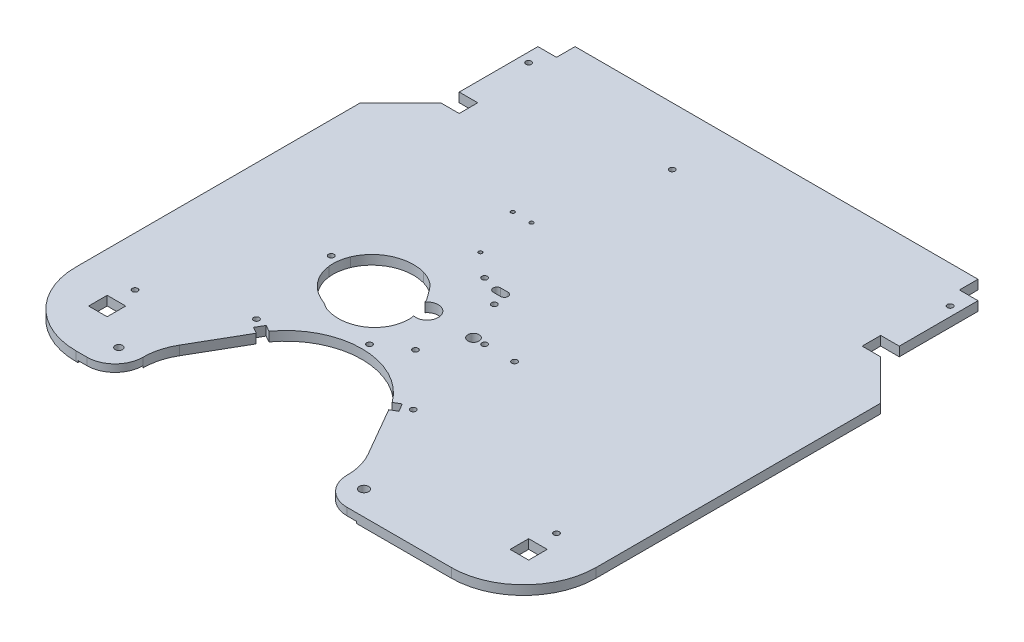
from build123d import *

# Parameters (mm, degrees)
ESQUISSE1_W              = 280.2
ESQUISSE1_H              = 276.282873123
BOSS_EXTRU_1_DEPTH       = 5
ESQUISSE2_R              = 1.5
ENL_V_MAT_EXTRU_2_DEPTH  = 283.344868376
ENL_V_MAT_EXTRU_3_DEPTH  = 283.344868376
ESQUISSE4_R              = 1
ENL_V_MAT_EXTRU_4_DEPTH  = 283.344868514
ESQUISSE5_R              = 1.5
ESQUISSE5_R_2            = 3
ENL_V_MAT_EXTRU_5_DEPTH  = 283.344868514
ESQUISSE6_R              = 6
ENL_V_MAT_EXTRU_6_DEPTH  = 283.344868514
ENL_V_MAT_EXTRU_7_DEPTH  = 283.344868514
ENL_V_MAT_EXTRU_8_DEPTH  = 283.344868514
ENL_V_MAT_EXTRU_9_DEPTH  = 283.344868514
ENL_V_MAT_EXTRU_10_DEPTH = 1
ESQUISSE11_W             = 10
ESQUISSE11_H             = 10
ENL_V_MAT_EXTRU_11_DEPTH = 283.344868514
ESQUISSE12_R             = 2.5
ESQUISSE12_R_2           = 2
ENL_V_MAT_EXTRU_12_DEPTH = 283.344868514
ESQUISSE13_R             = 1.5
ENL_V_MAT_EXTRU_15_DEPTH = 283.344868514


with BuildPart() as part:
    # Esquisse1 → Boss.-Extru.1 (new body)
    with BuildSketch(Plane(origin=(0, 0, 0), x_dir=(1, 0, 0), z_dir=(0, 1, 0))):
        with Locations((0, -106.941436562)):
            Rectangle(ESQUISSE1_W, ESQUISSE1_H)
    extrude(amount=BOSS_EXTRU_1_DEPTH)

    # Esquisse2 → Enlèv. mat.-Extru.2 (cut, through all)
    with BuildSketch(Plane(origin=(0, 0, 0), x_dir=(1, 0, 0), z_dir=(0, 1, 0))):
        with Locations((-67.225778058, -181.665063509)):
            Circle(ESQUISSE2_R)
        with Locations((17.225778058, -181.665063509)):
            Circle(ESQUISSE2_R)
        with BuildLine():
            Line((-58.181549424, -184), (-61.645651039, -182))
            Line((-61.645651039, -182), (-64.145651039, -186.330127019))
            Line((-64.145651039, -186.330127019), (-60.681549424, -188.330127019))
            Line((-60.681549424, -188.330127019), (-75.853895909, -214.609402001))
            ThreePointArc((-75.853895909, -214.609402001), (-78.945508514, -222.073215083), (-80, -230.082873123))
            ThreePointArc((-80, -230.082873123), (-84.393398282, -240.68947484), (-95, -245.082873123))
            Line((-95, -245.082873123), (45, -245.082873123))
            ThreePointArc((45, -245.082873123), (34.393398282, -240.68947484), (30, -230.082873123))
            ThreePointArc((30, -230.082873123), (28.945508514, -222.073215083), (25.853895909, -214.609402001))
            Line((25.853895909, -214.609402001), (10.681549424, -188.330127019))
            Line((10.681549424, -188.330127019), (14.145651039, -186.330127019))
            Line((14.145651039, -186.330127019), (11.645651039, -182))
            Line((11.645651039, -182), (8.181549424, -184))
            ThreePointArc((8.181549424, -184), (-25, -167.082873123), (-58.181549424, -184))
        make_face()
    extrude(amount=ENL_V_MAT_EXTRU_2_DEPTH, mode=Mode.SUBTRACT)

    # Esquisse3 → Enlèv. mat.-Extru.3 (cut, through all)
    with BuildSketch(Plane(origin=(0, 5, 0), x_dir=(1, 0, 0), z_dir=(0, 1, 0))):
        with BuildLine():
            Line((-30.219849208, -127.059608278), (-26.108908992, -139.132774718))
            add(Edge.make_bspline(
                [(-26.108908992, -139.132774718), (-25.956950527, -141.563829387), (-26.223293229, -144.068039694), (-26.956586016, -146.390839699)],
                knots=[0, 0, 0, 0, 1, 1, 1, 1], degree=3))
            add(Edge.make_bspline(
                [(-26.956586016, -146.390839699), (-27.222826546, -147.234191105), (-27.88312523, -148.88925138), (-29.202853962, -151.171032895), (-30.876306211, -153.274871062), (-32.153743683, -154.471165295), (-32.834022941, -155.024433994)],
                knots=[0, 0, 0, 0, 0.25, 0.5, 0.75, 1, 1, 1, 1], degree=3))
            add(Edge.make_bspline(
                [(-32.834022941, -155.024433994), (-34.081587302, -156.039073648), (-36.874142369, -157.737451773), (-39.94558254, -158.689126504), (-41.514400633, -158.98831152)],
                knots=[0, 0, 0, 0, 0.5, 1, 1, 1, 1], degree=3))
            add(Edge.make_bspline(
                [(-41.514400633, -158.98831152), (-44.117830219, -159.48480447), (-46.861254472, -159.483236641), (-49.46544784, -158.990765567)],
                knots=[0, 0, 0, 0, 1, 1, 1, 1], degree=3))
            add(Edge.make_bspline(
                [(-49.46544784, -158.990765567), (-49.951989881, -158.898757084), (-50.920132947, -158.680457167), (-51.984284706, -158.361141736), (-52.689516881, -158.115271255), (-53.02787714, -157.990279841), (-53.41118137, -157.84363537), (-53.818530417, -157.638563211), (-54.141104483, -157.453850504), (-54.472608463, -157.253723466), (-54.801717178, -157.036844169), (-54.998319522, -156.900216701), (-55.098918511, -156.830110672)],
                knots=[0, 0, 0, 0, 0.25, 0.5, 0.5625, 0.625, 0.6875, 0.75, 0.8125, 0.875, 0.9375, 1, 1, 1, 1], degree=3))
            add(Edge.make_bspline(
                [(-55.098918511, -156.830110672), (-55.3217742, -156.674805659), (-55.80044899, -156.330817244), (-56.33720149, -156.038962163), (-57.115277657, -155.704741536), (-58.107340958, -155.283125842), (-59.421209195, -154.724809933), (-60.695178463, -154.081458137), (-61.716195871, -153.475135599), (-62.651334353, -152.865127539), (-64.306065222, -151.716905995), (-66.442405301, -149.810998743), (-68.670825307, -147.137088975), (-71.028775534, -143.199014144), (-72.049582873, -139.81170379), (-72.320706317, -137.530983991)],
                knots=[0, 0, 0, 0, 0.03125, 0.0625, 0.09375, 0.125, 0.1875, 0.25, 0.28125, 0.3125, 0.375, 0.5, 0.625, 0.75, 1, 1, 1, 1], degree=3))
            add(Edge.make_bspline(
                [(-72.320706317, -137.530983991), (-72.524001857, -135.820839872), (-72.483207545, -132.329279177), (-71.564689145, -128.979569565), (-70.912675046, -127.389633094)],
                knots=[0, 0, 0, 0, 0.5, 1, 1, 1, 1], degree=3))
            add(Edge.make_bspline(
                [(-70.912675046, -127.389633094), (-70.401010457, -126.141938922), (-69.141056656, -123.747572814), (-66.565670024, -120.533413264), (-63.48146489, -117.931153097), (-59.920786428, -115.900931683), (-56.119376489, -114.563750704), (-52.089522484, -113.899386542), (-48.038217008, -113.946598208), (-45.368489458, -114.452209203), (-44.072416993, -114.824574117)],
                knots=[0, 0, 0, 0, 0.125, 0.25, 0.375, 0.5, 0.625, 0.75, 0.875, 1, 1, 1, 1], degree=3))
            add(Edge.make_bspline(
                [(-44.072416993, -114.824574117), (-43.133455735, -115.094340073), (-41.301452244, -115.753871763), (-39.094030914, -116.938824897), (-37.472293893, -118.085855767), (-36.300624784, -119.101293754), (-35.297198074, -120.192975728), (-34.68526159, -120.940027705), (-34.38448611, -121.321088922)],
                knots=[0, 0, 0, 0, 0.25, 0.5, 0.625, 0.75, 0.875, 1, 1, 1, 1], degree=3))
            add(Edge.make_bspline(
                [(-34.38448611, -121.321088922), (-33.65376, -122.246867115), (-32.598758637, -123.685666452), (-31.241615915, -125.567984762), (-30.544252063, -126.556620952), (-30.219849208, -127.059608278)],
                knots=[0, 0, 0, 0, 0.5, 0.75, 1, 1, 1, 1], degree=3))
        make_face()
    extrude(amount=-ENL_V_MAT_EXTRU_3_DEPTH, mode=Mode.SUBTRACT)

    # Esquisse4 → Enlèv. mat.-Extru.4 (cut, through all)
    with BuildSketch(Plane(origin=(0, 5, 0), x_dir=(1, 0, 0), z_dir=(0, 1, 0))):
        with Locations((-48.2, -62.65)):
            Circle(ESQUISSE4_R)
        with Locations((-38.1, -62.65)):
            Circle(ESQUISSE4_R)
        with Locations((-38.1, -90.25)):
            Circle(ESQUISSE4_R)
    extrude(amount=-ENL_V_MAT_EXTRU_4_DEPTH, mode=Mode.SUBTRACT)

    # Esquisse5 → Enlèv. mat.-Extru.5 (cut, through all)
    with BuildSketch(Plane(origin=(0, 5, 0), x_dir=(1, 0, 0), z_dir=(0, 1, 0))):
        with Locations((22.122359024, -132)):
            Circle(ESQUISSE5_R)
        with Locations((-10.050791121, -153.25)):
            Circle(ESQUISSE5_R)
        with Locations((-25, -163)):
            Circle(ESQUISSE5_R)
        with Locations((-10.050791121, -110.75)):
            Circle(ESQUISSE5_R)
        with Locations((-25, -101)):
            Circle(ESQUISSE5_R)
        with Locations((-76.6, -132)):
            Circle(ESQUISSE5_R)
        with Locations((6, -132)):
            Circle(ESQUISSE5_R)
        with Locations((0, -132)):
            Circle(ESQUISSE5_R_2)
    extrude(amount=-ENL_V_MAT_EXTRU_5_DEPTH, mode=Mode.SUBTRACT)

    # Esquisse6 → Enlèv. mat.-Extru.6 (cut, through all)
    with BuildSketch(Plane(origin=(0, 5, 0), x_dir=(1, 0, 0), z_dir=(0, 1, 0))):
        with Locations((-25, -132)):
            Circle(ESQUISSE6_R)
    extrude(amount=-ENL_V_MAT_EXTRU_6_DEPTH, mode=Mode.SUBTRACT)

    # Esquisse7 → Enlèv. mat.-Extru.7 (cut, through all)
    with BuildSketch(Plane(origin=(0, 5, 0), x_dir=(1, 0, 0), z_dir=(0, 1, 0))):
        with BuildLine():
            Line((-16, -101.4), (-12, -101.4))
            ThreePointArc((-12, -101.4), (-10, -103.4), (-12, -105.4))
            Line((-12, -105.4), (-16, -105.4))
            ThreePointArc((-16, -105.4), (-18, -103.4), (-16, -101.4))
        make_face()
    extrude(amount=-ENL_V_MAT_EXTRU_7_DEPTH, mode=Mode.SUBTRACT)

    # Esquisse8 → Enlèv. mat.-Extru.8 (cut, through all)
    with BuildSketch(Plane(origin=(0, 5, 0), x_dir=(1, 0, 0), z_dir=(0, 1, 0))):
        with BuildLine():
            Line((101.1, -245.082873123), (140.1, -245.082873123))
            Line((140.1, -245.082873123), (140.1, -206.082873123))
            ThreePointArc((140.1, -206.082873123), (128.677164466, -233.660037589), (101.1, -245.082873123))
        make_face()
        with BuildLine():
            Line((-140.1, -245.082873123), (-140.1, -206.082873123))
            ThreePointArc((-140.1, -206.082873123), (-128.677164466, -233.660037589), (-101.1, -245.082873123))
            Line((-101.1, -245.082873123), (-140.1, -245.082873123))
        make_face()
    extrude(amount=-ENL_V_MAT_EXTRU_8_DEPTH, mode=Mode.SUBTRACT)

    # Esquisse9 → Enlèv. mat.-Extru.9 (cut, through all)
    with BuildSketch(Plane(origin=(0, 5, 0), x_dir=(1, 0, 0), z_dir=(0, 1, 0))):
        Polygon((-108.5, 21.2), (-118.5, 21.2), (-118.5, -21.2), (-108.5, -21.2), (-108.5, -31.2), (-118.5, -31.2), (-140.1, -52.8), (-140.1, 31.2), (-108.5, 31.2), align=None)
        Polygon((140.1, 31.2), (108.5, 31.2), (108.5, 21.2), (118.5, 21.2), (118.5, -21.2), (108.5, -21.2), (108.5, -31.2), (118.5, -31.2), (140.1, -52.8), align=None)
    extrude(amount=-ENL_V_MAT_EXTRU_9_DEPTH, mode=Mode.SUBTRACT)

    # Esquisse10 → Enlèv. mat.-Extru.10 (cut)
    with BuildSketch(Plane.XZ):
        with BuildLine():
            Line((50, 242.082873123), (50, 245.082873123))
            Line((50, 245.082873123), (45, 245.082873123))
            ThreePointArc((45, 245.082873123), (30.714652713, 234.657679446), (36.286307054, 217.873386842))
            ThreePointArc((36.286307054, 217.873386842), (75.473609251, 99.823862194), (-25, 26.5))
            ThreePointArc((-25, 26.5), (-125.473609251, 99.823862194), (-86.286307054, 217.873386842))
            ThreePointArc((-86.286307054, 217.873386842), (-80.714652713, 234.657679446), (-95, 245.082873123))
            Line((-95, 245.082873123), (-100, 245.082873123))
            Line((-100, 245.082873123), (-100, 242.082873123))
            Line((-100, 242.082873123), (-95, 242.082873123))
            ThreePointArc((-95, 242.082873123), (-83.571722171, 233.742718181), (-88.029045643, 220.315284098))
            ThreePointArc((-88.029045643, 220.315284098), (-128.330678708, 98.90890093), (-25, 23.5))
            ThreePointArc((-25, 23.5), (78.330678708, 98.90890093), (38.029045643, 220.315284098))
            ThreePointArc((38.029045643, 220.315284098), (33.571722171, 233.742718181), (45, 242.082873123))
            Line((45, 242.082873123), (50, 242.082873123))
        make_face()
    extrude(amount=-ENL_V_MAT_EXTRU_10_DEPTH, mode=Mode.SUBTRACT)

    # Esquisse11 → Enlèv. mat.-Extru.11 (cut, through all)
    with BuildSketch(Plane(origin=(0, 5, 0), x_dir=(1, 0, 0), z_dir=(0, 1, 0))):
        with Locations((-113.5, -215.8)):
            Rectangle(ESQUISSE11_W, ESQUISSE11_H)
        with Locations((113.5, -215.8)):
            Rectangle(ESQUISSE11_W, ESQUISSE11_H)
    extrude(amount=-ENL_V_MAT_EXTRU_11_DEPTH, mode=Mode.SUBTRACT)

    # Esquisse12 → Enlèv. mat.-Extru.12 (cut, through all)
    with BuildSketch(Plane(origin=(0, 5, 0), x_dir=(1, 0, 0), z_dir=(0, 1, 0))):
        with Locations((41, -232)):
            Circle(ESQUISSE12_R)
        with Locations((-91, -232)):
            Circle(ESQUISSE12_R_2)
    extrude(amount=-ENL_V_MAT_EXTRU_12_DEPTH, mode=Mode.SUBTRACT)

    # Esquisse13 → Enlèv. mat.-Extru.15 (cut, through all)
    with BuildSketch(Plane(origin=(0, 5, 0), x_dir=(1, 0, 0), z_dir=(0, 1, 0))):
        with Locations((-113.5, -200.8)):
            Circle(ESQUISSE13_R)
        with Locations((-113.5, 11.2)):
            Circle(ESQUISSE13_R)
        with Locations((113.5, 11.2)):
            Circle(ESQUISSE13_R)
        with Locations((113.5, -200.8)):
            Circle(ESQUISSE13_R)
        with Locations((-25, 0)):
            Circle(ESQUISSE13_R)
    extrude(amount=-ENL_V_MAT_EXTRU_15_DEPTH, mode=Mode.SUBTRACT)


solid = part.part
